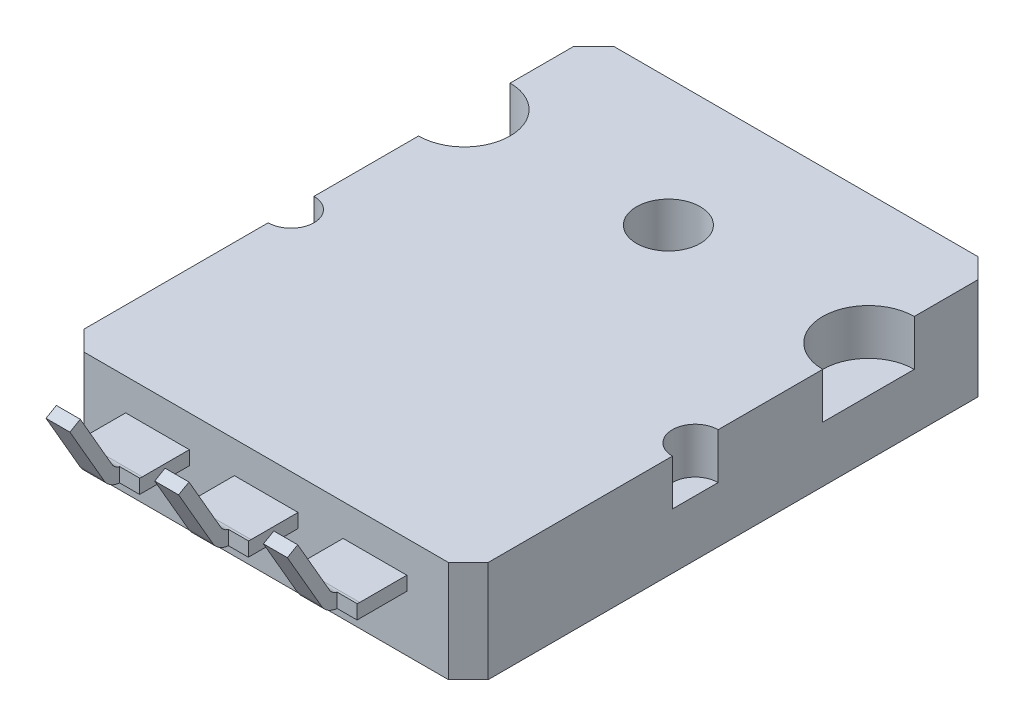
from build123d import *

# Parameters (mm, degrees)
SKETCH_1_W                  = 20.3
SKETCH_1_H                  = 26.6
EXTRUDE_1_DEPTH             = 5.1
SKETCH_2_W                  = 3.2
SKETCH_2_H                  = 0.7
EXTRUDE_2_DEPTH             = 3
SKETCH_3_W                  = 1
SKETCH_3_H                  = 2.5
CUT_EXTRUDE_1_DEPTH         = 20.404960706
SKETCH_4_W                  = 1
SKETCH_4_H                  = 2.5
CUT_EXTRUDE_2_DEPTH         = 20.404960706
SKETCH_6_W                  = 3.2
SKETCH_6_H                  = 0.7
EXTRUDE_4_DEPTH             = 3
SKETCH_7_W                  = 1
SKETCH_7_H                  = 2.5
CUT_EXTRUDE_3_DEPTH         = 20.404960706
SKETCH_8_W                  = 1
SKETCH_8_H                  = 2.5
CUT_EXTRUDE_4_DEPTH         = 20.404960706
SKETCH_10_W                 = 3.2
SKETCH_10_H                 = 0.7
EXTRUDE_6_DEPTH             = 3
SKETCH_11_W                 = 1
SKETCH_11_H                 = 2.5
CUT_EXTRUDE_5_DEPTH         = 20.404960706
SKETCH_12_W                 = 1
SKETCH_12_H                 = 2.5
CUT_EXTRUDE_6_DEPTH         = 20.404960706
HOLE_WIZARD_3_2_3_2_1_D     = 3.2
HOLE_WIZARD_2_3_2_3_1_D     = 2.3
HOLE_WIZARD_2_3_2_3_1_DEPTH = 2.3
HOLE_WIZARD_4_6_4_6_1_D     = 4.6
HOLE_WIZARD_4_6_4_6_1_DEPTH = 2.3
CHAMFER_1_SIZE              = 1
SKETCH_20_R                 = 1.6
CUT_EXTRUDE_7_DEPTH         = 1.5
SKETCH_21_W                 = 1.2
SKETCH_21_H                 = 0.6
EXTRUDE_10_DEPTH            = 4
FILLET_1_R                  = 1
FILLET_2_R                  = 0.6


with BuildPart() as part:
    # Эскиз1 → Бобышка-Вытянуть1 (new body)
    with BuildSketch(Plane(origin=(0, 2.3, 0), x_dir=(1, 0, 0), z_dir=(0, 1, 0))):
        Rectangle(SKETCH_1_W, SKETCH_1_H)
    extrude(amount=-EXTRUDE_1_DEPTH)

    # Эскиз2 → Бобышка-Вытянуть2 (add)
    with BuildSketch(Plane.XY.offset(13.3)):
        with Locations((5.461, 0.35)):
            Rectangle(SKETCH_2_W, SKETCH_2_H)
    extrude(amount=EXTRUDE_2_DEPTH)

    # Эскиз3 → Вырез-Вытянуть1 (cut, through all)
    with BuildSketch(Plane.XZ):
        with Locations((4.361, 17.05)):
            Rectangle(SKETCH_3_W, SKETCH_3_H)
    extrude(amount=-CUT_EXTRUDE_1_DEPTH, mode=Mode.SUBTRACT)

    # Эскиз4 → Вырез-Вытянуть2 (cut, through all)
    with BuildSketch(Plane.XZ):
        with Locations((6.561, 17.05)):
            Rectangle(SKETCH_4_W, SKETCH_4_H)
    extrude(amount=-CUT_EXTRUDE_2_DEPTH, mode=Mode.SUBTRACT)

    # Эскиз6 → Бобышка-Вытянуть4 (add)
    with BuildSketch(Plane.XY.offset(13.3)):
        with Locations((0, 0.35)):
            Rectangle(SKETCH_6_W, SKETCH_6_H)
    extrude(amount=EXTRUDE_4_DEPTH)

    # Эскиз7 → Вырез-Вытянуть3 (cut, through all)
    with BuildSketch(Plane.XZ):
        with Locations((-1.1, 17.05)):
            Rectangle(SKETCH_7_W, SKETCH_7_H)
    extrude(amount=-CUT_EXTRUDE_3_DEPTH, mode=Mode.SUBTRACT)

    # Эскиз8 → Вырез-Вытянуть4 (cut, through all)
    with BuildSketch(Plane.XZ):
        with Locations((1.1, 17.05)):
            Rectangle(SKETCH_8_W, SKETCH_8_H)
    extrude(amount=-CUT_EXTRUDE_4_DEPTH, mode=Mode.SUBTRACT)

    # Эскиз10 → Бобышка-Вытянуть6 (add)
    with BuildSketch(Plane.XY.offset(13.3)):
        with Locations((-5.461, 0.35)):
            Rectangle(SKETCH_10_W, SKETCH_10_H)
    extrude(amount=EXTRUDE_6_DEPTH)

    # Эскиз11 → Вырез-Вытянуть5 (cut, through all)
    with BuildSketch(Plane.XZ):
        with Locations((-6.561, 17.05)):
            Rectangle(SKETCH_11_W, SKETCH_11_H)
    extrude(amount=-CUT_EXTRUDE_5_DEPTH, mode=Mode.SUBTRACT)

    # Эскиз12 → Вырез-Вытянуть6 (cut, through all)
    with BuildSketch(Plane.XZ):
        with Locations((-4.361, 17.05)):
            Rectangle(SKETCH_12_W, SKETCH_12_H)
    extrude(amount=-CUT_EXTRUDE_6_DEPTH, mode=Mode.SUBTRACT)

    # Диаметр отверстия Ø3.2 (3.2)1 (through all)
    with Locations(Plane(origin=(0, 2.3, 0), x_dir=(1, 0, 0), z_dir=(0, 1, 0))):
        with Locations((0, 6.9)):
            Hole(HOLE_WIZARD_3_2_3_2_1_D / 2)

    # Диаметр отверстия Ø2.3 (2.3)1
    with Locations(Plane(origin=(0, 2.3, 0), x_dir=(1, 0, 0), z_dir=(0, 1, 0))):
        with Locations((10.15, -1.9), (-10.15, -1.9)):
            Hole(HOLE_WIZARD_2_3_2_3_1_D / 2, depth=HOLE_WIZARD_2_3_2_3_1_DEPTH)

    # Диаметр отверстия Ø4.6 (4.6)1
    with Locations(Plane(origin=(0, 2.3, 0), x_dir=(1, 0, 0), z_dir=(0, 1, 0))):
        with Locations((10.15, 6.8), (-10.15, 6.8)):
            Hole(HOLE_WIZARD_4_6_4_6_1_D / 2, depth=HOLE_WIZARD_4_6_4_6_1_DEPTH)

    # Фаска1
    chamfer_1_edges = [part.edges().sort_by_distance(p)[0] for p in [
        (10.15, -0.25, 13.3),
        (-10.15, -0.25, 13.3),
        (10.15, -0.25, -13.3),
        (-10.15, -0.25, -13.3),
    ]]
    chamfer(chamfer_1_edges, length=CHAMFER_1_SIZE)

    # Эскиз20 → Вырез-Вытянуть7 (cut)
    with BuildSketch(Plane.XZ.offset(2.8)):
        Polygon((8.735786438, -12.3), (9.15, -11.885786438), (9.15, 11.885786438), (8.735786438, 12.3), (-8.735786438, 12.3), (-9.15, 11.885786438), (-9.15, -11.885786438), (-8.735786438, -12.3), align=None)
        with Locations((0, -6.9)):
            Circle(SKETCH_20_R, mode=Mode.SUBTRACT)
    extrude(amount=-CUT_EXTRUDE_7_DEPTH, mode=Mode.SUBTRACT)

    # Эскиз21 → Бобышка-Вытянуть10 (add)
    with BuildSketch(Plane(origin=(0, 7.058107041, 4.075), x_dir=(1, 0, 0), z_dir=(0, -0.8660254037844364, -0.5000000000000041))):
        with Locations((-5.461, 13.816214082)):
            Rectangle(SKETCH_21_W, SKETCH_21_H)
        with Locations((0, 13.816214082)):
            Rectangle(SKETCH_21_W, SKETCH_21_H)
        with Locations((5.461, 13.816214082)):
            Rectangle(SKETCH_21_W, SKETCH_21_H)
    extrude(amount=-EXTRUDE_10_DEPTH)

    # Скругление1
    fillet_1_edges = [part.edges().sort_by_distance(p)[0] for p in [
        (5.461, 0, 16.3),
        (0, 0, 16.3),
        (-5.461, 0, 16.3),
    ]]
    fillet(fillet_1_edges, radius=FILLET_1_R)

    # Скругление2
    fillet_2_edges = [part.edges().sort_by_distance(p)[0] for p in [
        (-5.461, 0.7, 16.011324865),
        (0, 0.7, 16.011324865),
        (5.461, 0.7, 16.011324865),
    ]]
    fillet(fillet_2_edges, radius=FILLET_2_R)


solid = part.part
